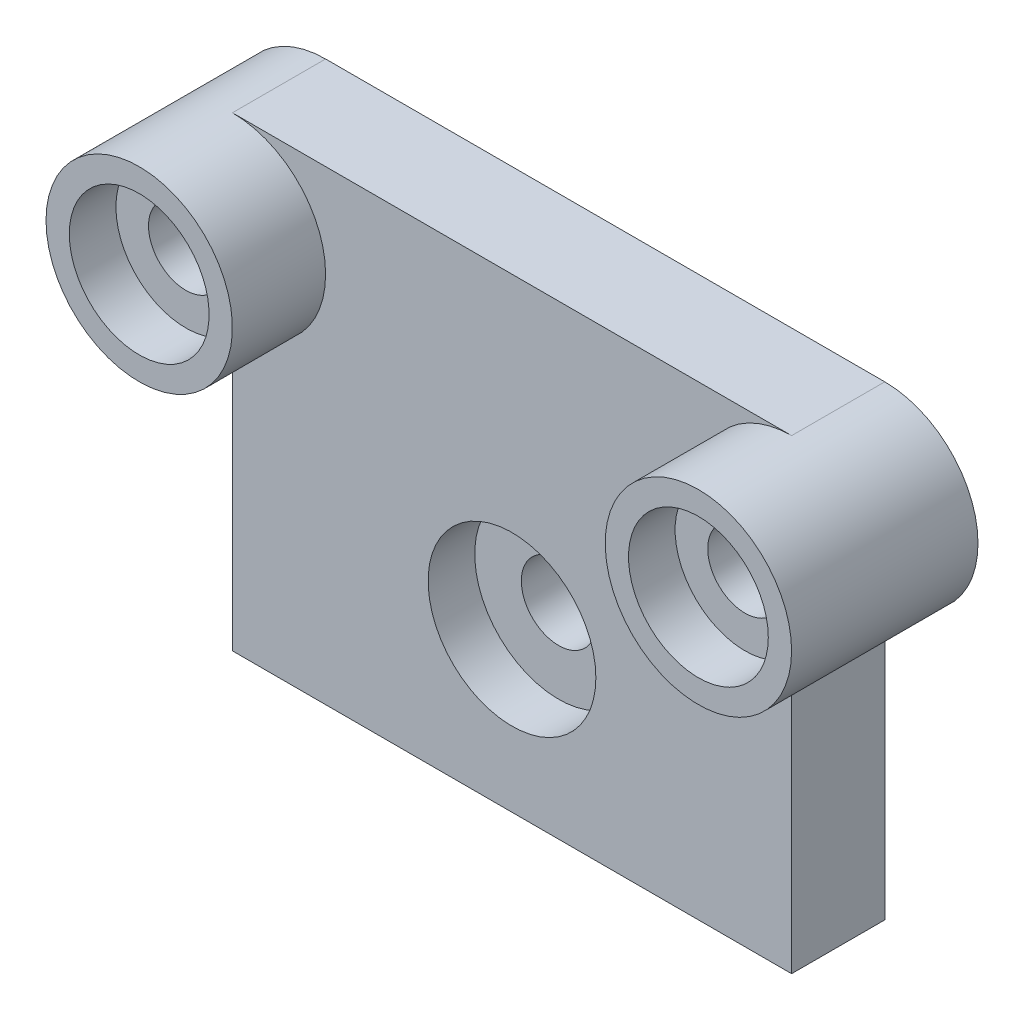
from build123d import *
from build123d.topology import SkipClean

# Parameters (mm, degrees)
SKETCH_1_R          = 4
EXTRUDE_1_DEPTH     = 10
SKETCH_1_3_R        = 10
SKETCH_1_3_R_2      = 4
EXTRUDE_2_DEPTH     = 20
SKETCH_3_R          = 7.5
CUT_EXTRUDE_1_DEPTH = 5
SKETCH_6_R          = 9
CUT_EXTRUDE_2_DEPTH = 5


with BuildPart() as part:
    # Эскиз1 → Бобышка-Вытянуть1 (new body)
    with BuildSketch(Plane.XY):
        with BuildLine():
            Line((-15, -25), (15, -25))
            Line((15, -25), (15, 5))
            ThreePointArc((15, 5), (25, 15), (15, 25))
            Line((15, 25), (-15, 25))
            Line((-15, 25), (-15, -4))
            ThreePointArc((-15, -4), (-11, -8), (-15, -12))
            Line((-15, -12), (-15, -25))
        make_face()
        with Locations((15, 15)):
            Circle(SKETCH_1_R, mode=Mode.SUBTRACT)
    extrude_1 = extrude(amount=EXTRUDE_1_DEPTH)

    # Эскиз1<3> → Бобышка-Вытянуть2 (add)
    with BuildSketch(Plane.XY):
        with Locations((15, 15)):
            Circle(SKETCH_1_3_R)
        with Locations((15, 15)):
            Circle(SKETCH_1_3_R_2, mode=Mode.SUBTRACT)
    extrude_2 = extrude(amount=EXTRUDE_2_DEPTH)

    # Эскиз3 → Вырез-Вытянуть1 (cut)
    with BuildSketch(Plane.XY.offset(20)):
        with Locations((15, 15)):
            Circle(SKETCH_3_R)
    cut_extrude_1 = extrude(amount=-CUT_EXTRUDE_1_DEPTH, mode=Mode.SUBTRACT)

    # Зеркальное отражение1: Бобышка-Вытянуть1, Бобышка-Вытянуть2, Вырез-Вытянуть1 across plane
    with SkipClean():  # the faces are left unmerged after this step: merging them gives an invalid solid
        add(extrude_1.mirror(Plane(origin=(-15, 0, 10), x_dir=(0, 0, 1), z_dir=(-1, 0, 0))))
        add(extrude_2.mirror(Plane(origin=(-15, 0, 10), x_dir=(0, 0, 1), z_dir=(-1, 0, 0))))
        add(cut_extrude_1.mirror(Plane(origin=(-15, 0, 10), x_dir=(0, 0, 1), z_dir=(-1, 0, 0))), mode=Mode.SUBTRACT)

    # Эскиз6 → Вырез-Вытянуть2 (cut)
    with SkipClean():  # the faces are left unmerged after this step: merging them gives an invalid solid
        with BuildSketch(Plane.XY.offset(10)):
            with Locations((-15, -8)):
                Circle(SKETCH_6_R)
        extrude(amount=-CUT_EXTRUDE_2_DEPTH, mode=Mode.SUBTRACT)


solid = part.part
